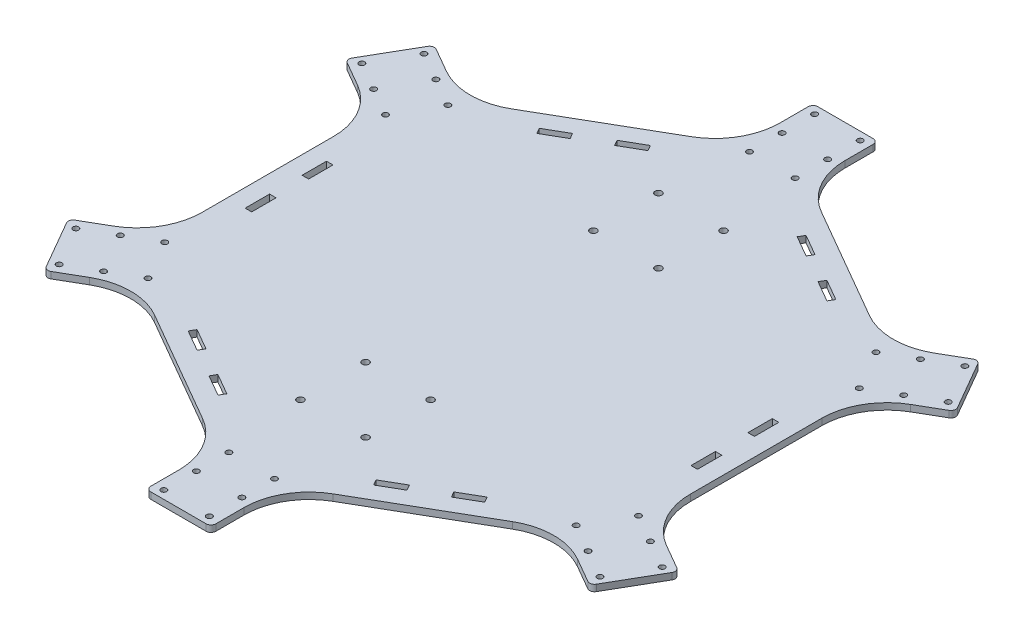
from build123d import *

# Parameters (mm, degrees)
SKETCH4_R                  = 1.75
SKETCH4_W                  = 4
SKETCH4_H                  = 15
BOSS_EXTRUDE3_DEPTH        = 2
FILLET1_R                  = 3
CIRPATTERN4_START          = -2
CIRPATTERN4_DEPTH          = 4
M5_TAPPED_HOLE1_AT_2_COUNT = 2
M5_TAPPED_HOLE1_AT_2_PITCH = 40
M5_TAPPED_HOLE1_AT_3_COUNT = 2
M5_TAPPED_HOLE1_AT_3_PITCH = 40
M5_TAPPED_HOLE1_AT_4_COUNT = 2
M5_TAPPED_HOLE1_AT_4_PITCH = 56.568542495


# Read off the part's stored shape, not the designer's step: CirPattern4
with BuildPart() as part:
    # Sketch4 → Boss-Extrude3 (new, symmetric)
    with BuildSketch(Plane(origin=(0, 0, 0), x_dir=(1, 0, 0), z_dir=(0, 1, 0))):
        with BuildLine():
            Line((-109.999962696, -109.696549489), (-39.999982783, -150.111103124))
            ThreePointArc((-39.999982783, -150.111103124), (-25.358978878, -164.752117943), (-20, -184.752109335))
            Line((-20, -184.752109335), (-20, -205))
            Line((-20, -205), (20, -205))
            Line((20, -205), (20, -184.752062947))
            ThreePointArc((20, -184.752062947), (25.358988819, -164.752054338), (40.000017217, -150.111036855))
            Line((40.000017217, -150.111036855), (110.000037304, -109.696552803))
            ThreePointArc((110.000037304, -109.696552803), (130.000030027, -104.337578894), (150.000020087, -109.696562743))
            Line((150.000020087, -109.696562743), (167.535207776, -119.820508076))
            Line((167.535207776, -119.820508076), (187.535207776, -85.179491924))
            Line((187.535207776, -85.179491924), (169.999979913, -75.055523398))
            ThreePointArc((169.999979913, -75.055523398), (155.358958792, -60.414498638), (149.999979913, -40.414487366))
            Line((149.999979913, -40.414487366), (150.000020087, 40.414550321))
            ThreePointArc((150.000020087, 40.414550321), (155.359008905, 60.414539049), (170.000020087, 75.055546592))
            Line((170.000020087, 75.055546592), (187.535207776, 85.179491924))
            Line((187.535207776, 85.179491924), (167.535207776, 119.820508076))
            Line((167.535207776, 119.820508076), (149.999979913, 109.696539549))
            ThreePointArc((149.999979913, 109.696539549), (129.999969973, 104.3375557), (109.999962696, 109.696549489))
            Line((109.999962696, 109.696549489), (39.999982783, 150.111103124))
            ThreePointArc((39.999982783, 150.111103124), (25.358978878, 164.752117943), (20, 184.752109335))
            Line((20, 184.752109335), (20, 205))
            Line((20, 205), (-20, 205))
            Line((-20, 205), (-20, 184.752062947))
            ThreePointArc((-20, 184.752062947), (-25.358988819, 164.752054338), (-40.000017217, 150.111036855))
            Line((-40.000017217, 150.111036855), (-110.000037304, 109.696552803))
            ThreePointArc((-110.000037304, 109.696552803), (-130.000030027, 104.337578894), (-150.000020087, 109.696562743))
            Line((-150.000020087, 109.696562743), (-167.535207776, 119.820508076))
            Line((-167.535207776, 119.820508076), (-187.535207776, 85.179491924))
            Line((-187.535207776, 85.179491924), (-169.999979913, 75.055523398))
            ThreePointArc((-169.999979913, 75.055523398), (-155.358958792, 60.414498638), (-149.999979913, 40.414487366))
            Line((-149.999979913, 40.414487366), (-150.000020087, -40.414550321))
            ThreePointArc((-150.000020087, -40.414550321), (-155.359008905, -60.414539049), (-170.000020087, -75.055546592))
            Line((-170.000020087, -75.055546592), (-187.535207776, -85.179491924))
            Line((-187.535207776, -85.179491924), (-167.535207776, -119.820508076))
            Line((-167.535207776, -119.820508076), (-149.999979913, -109.696539549))
            ThreePointArc((-149.999979913, -109.696539549), (-129.999969973, -104.3375557), (-109.999962696, -109.696549489))
        make_face()
        with Locations(Location((-14, 200, 0), (0, 0, 270))):
            Circle(SKETCH4_R, mode=Mode.SUBTRACT)
        with Locations(Location((-14, 180, 0), (0, 0, 270))):
            Circle(SKETCH4_R, mode=Mode.SUBTRACT)
        with Locations(Location((-14, 160, 0), (0, 0, 270))):
            Circle(SKETCH4_R, mode=Mode.SUBTRACT)
        with Locations(Location((14, 200, 0), (0, 0, 270))):
            Circle(SKETCH4_R, mode=Mode.SUBTRACT)
        with Locations(Location((14, 180, 0), (0, 0, 270))):
            Circle(SKETCH4_R, mode=Mode.SUBTRACT)
        with Locations(Location((14, 160, 0), (0, 0, 270))):
            Circle(SKETCH4_R, mode=Mode.SUBTRACT)
        with Locations(Location((131.564064606, 92.124355653, 0), (0, 0, 270))):
            Circle(SKETCH4_R, mode=Mode.SUBTRACT)
        with Locations(Location((148.884572681, 102.124355653, 0), (0, 0, 270))):
            Circle(SKETCH4_R, mode=Mode.SUBTRACT)
        with Locations(Location((145.564064606, 67.875644347, 0), (0, 0, 270))):
            Circle(SKETCH4_R, mode=Mode.SUBTRACT)
        with Locations(Location((180.205080757, 87.875644347, 0), (0, 0, 270))):
            Circle(SKETCH4_R, mode=Mode.SUBTRACT)
        with Locations(Location((162.884572681, 77.875644347, 0), (0, 0, 270))):
            Circle(SKETCH4_R, mode=Mode.SUBTRACT)
        with Locations(Location((166.205080757, 112.124355653, 0), (0, 0, 270))):
            Circle(SKETCH4_R, mode=Mode.SUBTRACT)
        with Locations(Location((145.564064606, -67.875644347, 0), (0, 0, 270))):
            Circle(SKETCH4_R, mode=Mode.SUBTRACT)
        with Locations(Location((162.884572681, -77.875644347, 0), (0, 0, 270))):
            Circle(SKETCH4_R, mode=Mode.SUBTRACT)
        with Locations(Location((131.564064606, -92.124355653, 0), (0, 0, 270))):
            Circle(SKETCH4_R, mode=Mode.SUBTRACT)
        with Locations(Location((166.205080757, -112.124355653, 0), (0, 0, 270))):
            Circle(SKETCH4_R, mode=Mode.SUBTRACT)
        with Locations(Location((148.884572681, -102.124355653, 0), (0, 0, 270))):
            Circle(SKETCH4_R, mode=Mode.SUBTRACT)
        with Locations(Location((180.205080757, -87.875644347, 0), (0, 0, 270))):
            Circle(SKETCH4_R, mode=Mode.SUBTRACT)
        with Locations(Location((14, -160, 0), (0, 0, 270))):
            Circle(SKETCH4_R, mode=Mode.SUBTRACT)
        with Locations(Location((14, -180, 0), (0, 0, 270))):
            Circle(SKETCH4_R, mode=Mode.SUBTRACT)
        with Locations(Location((-14, -160, 0), (0, 0, 270))):
            Circle(SKETCH4_R, mode=Mode.SUBTRACT)
        with Locations(Location((-14, -200, 0), (0, 0, 270))):
            Circle(SKETCH4_R, mode=Mode.SUBTRACT)
        with Locations(Location((-14, -180, 0), (0, 0, 270))):
            Circle(SKETCH4_R, mode=Mode.SUBTRACT)
        with Locations(Location((14, -200, 0), (0, 0, 270))):
            Circle(SKETCH4_R, mode=Mode.SUBTRACT)
        with Locations(Location((-131.564064605, -92.124355653, 0), (0, 0, 270))):
            Circle(SKETCH4_R, mode=Mode.SUBTRACT)
        with Locations(Location((-148.884572681, -102.124355653, 0), (0, 0, 270))):
            Circle(SKETCH4_R, mode=Mode.SUBTRACT)
        with Locations(Location((-145.564064605, -67.875644347, 0), (0, 0, 270))):
            Circle(SKETCH4_R, mode=Mode.SUBTRACT)
        with Locations(Location((-180.205080757, -87.875644347, 0), (0, 0, 270))):
            Circle(SKETCH4_R, mode=Mode.SUBTRACT)
        with Locations(Location((-162.884572681, -77.875644347, 0), (0, 0, 270))):
            Circle(SKETCH4_R, mode=Mode.SUBTRACT)
        with Locations(Location((-166.205080757, -112.124355653, 0), (0, 0, 270))):
            Circle(SKETCH4_R, mode=Mode.SUBTRACT)
        with Locations(Location((-145.564064606, 67.875644347, 0), (0, 0, 270))):
            Circle(SKETCH4_R, mode=Mode.SUBTRACT)
        with Locations(Location((-162.884572681, 77.875644347, 0), (0, 0, 270))):
            Circle(SKETCH4_R, mode=Mode.SUBTRACT)
        with Locations(Location((-131.564064606, 92.124355653, 0), (0, 0, 270))):
            Circle(SKETCH4_R, mode=Mode.SUBTRACT)
        with Locations(Location((-166.205080757, 112.124355653, 0), (0, 0, 270))):
            Circle(SKETCH4_R, mode=Mode.SUBTRACT)
        with Locations(Location((-148.884572681, 102.124355653, 0), (0, 0, 270))):
            Circle(SKETCH4_R, mode=Mode.SUBTRACT)
        with Locations(Location((-180.205080757, 87.875644347, 0), (0, 0, 270))):
            Circle(SKETCH4_R, mode=Mode.SUBTRACT)
        with Locations((137, 17.5)):
            Rectangle(SKETCH4_W, SKETCH4_H, mode=Mode.SUBTRACT)
        with Locations((137, -17.5)):
            Rectangle(SKETCH4_W, SKETCH4_H, mode=Mode.SUBTRACT)
        Polygon((60.839745962, -125.377531126), (47.849364905, -132.877531126), (45.849364905, -129.413429511), (58.839745962, -121.913429511), align=None, mode=Mode.SUBTRACT)
        Polygon((76.160254038, -111.913429511), (78.160254038, -115.377531126), (91.150635095, -107.877531126), (89.150635095, -104.413429511), align=None, mode=Mode.SUBTRACT)
        Polygon((-78.160254038, -115.377531126), (-91.150635095, -107.877531126), (-89.150635095, -104.413429511), (-76.160254038, -111.913429511), align=None, mode=Mode.SUBTRACT)
        Polygon((-58.839745962, -121.913429511), (-60.839745962, -125.377531126), (-47.849364905, -132.877531126), (-45.849364905, -129.413429511), align=None, mode=Mode.SUBTRACT)
        with Locations((-137, 17.5)):
            Rectangle(SKETCH4_W, SKETCH4_H, mode=Mode.SUBTRACT)
        with Locations((-137, -17.5)):
            Rectangle(SKETCH4_W, SKETCH4_H, mode=Mode.SUBTRACT)
        Polygon((-60.839745962, 125.377531126), (-47.849364905, 132.877531126), (-45.849364905, 129.413429511), (-58.839745962, 121.913429511), align=None, mode=Mode.SUBTRACT)
        Polygon((-76.160254038, 111.913429511), (-78.160254038, 115.377531126), (-91.150635095, 107.877531126), (-89.150635095, 104.413429511), align=None, mode=Mode.SUBTRACT)
        Polygon((78.160254038, 115.377531126), (91.150635095, 107.877531126), (89.150635095, 104.413429511), (76.160254038, 111.913429511), align=None, mode=Mode.SUBTRACT)
        Polygon((58.839745962, 121.913429511), (60.839745962, 125.377531126), (47.849364905, 132.877531126), (45.849364905, 129.413429511), align=None, mode=Mode.SUBTRACT)
    extrude(amount=BOSS_EXTRUDE3_DEPTH, both=True)

    # Fillet1
    fillet1_edges = [part.edges().sort_by_distance(p)[0] for p in [
        (-20, 0, -205),
        (20, 0, -205),
    ]]
    fillet(fillet1_edges, radius=FILLET1_R)

    # CirPattern4 outline → CirPattern4 (cut)
    with BuildSketch(Plane(origin=(0, 0, 0), x_dir=(1, 0, 0), z_dir=(0, 1, 0)).offset(CIRPATTERN4_START)):
        with BuildLine():
            Line((187.535207776, 85.179491924), (186.035207776, 87.777568136))
            ThreePointArc((186.035207776, 87.777568136), (186.334909043, 85.501111), (184.937131564, 83.679491924))
            Line((184.937131564, 83.679491924), (187.535207776, 85.179491924))
        make_face()
        with BuildLine():
            ThreePointArc((164.937131564, 118.320508076), (167.2135887, 118.620209343), (169.035207776, 117.222431864))
            Line((169.035207776, 117.222431864), (167.535207776, 119.820508076))
            Line((167.535207776, 119.820508076), (164.937131564, 118.320508076))
        make_face()
        with BuildLine():
            Line((167.535207776, -119.820508076), (169.035207776, -117.222431864))
            ThreePointArc((169.035207776, -117.222431864), (167.2135887, -118.620209343), (164.937131564, -118.320508076))
            Line((164.937131564, -118.320508076), (167.535207776, -119.820508076))
        make_face()
        with BuildLine():
            ThreePointArc((184.937131564, -83.679491924), (186.334909043, -85.501111), (186.035207776, -87.777568136))
            Line((186.035207776, -87.777568136), (187.535207776, -85.179491924))
            Line((187.535207776, -85.179491924), (184.937131564, -83.679491924))
        make_face()
        with BuildLine():
            Line((-20, -205), (-17, -205))
            ThreePointArc((-17, -205), (-19.121320344, -204.121320344), (-20, -202))
            Line((-20, -202), (-20, -205))
        make_face()
        with BuildLine():
            ThreePointArc((20, -202), (19.121320343, -204.121320344), (17, -205))
            Line((17, -205), (20, -205))
            Line((20, -205), (20, -202))
        make_face()
        with BuildLine():
            Line((-187.535207776, -85.179491924), (-186.035207776, -87.777568136))
            ThreePointArc((-186.035207776, -87.777568136), (-186.334909043, -85.501111), (-184.937131564, -83.679491924))
            Line((-184.937131564, -83.679491924), (-187.535207776, -85.179491924))
        make_face()
        with BuildLine():
            ThreePointArc((-164.937131564, -118.320508076), (-167.2135887, -118.620209343), (-169.035207776, -117.222431864))
            Line((-169.035207776, -117.222431864), (-167.535207776, -119.820508076))
            Line((-167.535207776, -119.820508076), (-164.937131564, -118.320508076))
        make_face()
        with BuildLine():
            Line((-167.535207776, 119.820508076), (-169.035207776, 117.222431864))
            ThreePointArc((-169.035207776, 117.222431864), (-167.2135887, 118.620209343), (-164.937131564, 118.320508076))
            Line((-164.937131564, 118.320508076), (-167.535207776, 119.820508076))
        make_face()
        with BuildLine():
            ThreePointArc((-184.937131564, 83.679491924), (-186.334909043, 85.501111), (-186.035207776, 87.777568136))
            Line((-186.035207776, 87.777568136), (-187.535207776, 85.179491924))
            Line((-187.535207776, 85.179491924), (-184.937131564, 83.679491924))
        make_face()
    extrude(amount=CIRPATTERN4_DEPTH, mode=Mode.SUBTRACT)

    # Sketch16 → M5 Tapped Hole1 (revolve, cut)
    with BuildSketch(Plane(origin=(-20, 2, -110), x_dir=(0, 0, 1), z_dir=(1, 0, 0))):
        Polygon((0, 0), (0, 15.2618073), (2.1, 14), (2.1, 0), align=None)
    m5_tapped_hole1 = revolve(axis=Axis((-20, 8.35, -110), (0, -1, 0)), mode=Mode.SUBTRACT)

    # M5 Tapped Hole1 at 2: M5 Tapped Hole1 ×2
    with Locations(*[(0, 0, i * M5_TAPPED_HOLE1_AT_2_PITCH) for i in range(1, M5_TAPPED_HOLE1_AT_2_COUNT)]):
        add(m5_tapped_hole1, mode=Mode.SUBTRACT)

    # M5 Tapped Hole1 at 3: M5 Tapped Hole1 ×2
    with Locations(*[(i * M5_TAPPED_HOLE1_AT_3_PITCH, 0, 0) for i in range(1, M5_TAPPED_HOLE1_AT_3_COUNT)]):
        add(m5_tapped_hole1, mode=Mode.SUBTRACT)

    # M5 Tapped Hole1 at 4: M5 Tapped Hole1 ×2
    with Locations(*[Vector(0.7071067811865475, 0, 0.7071067811865477) * (i * M5_TAPPED_HOLE1_AT_4_PITCH) for i in range(1, M5_TAPPED_HOLE1_AT_4_COUNT)]):
        add(m5_tapped_hole1, mode=Mode.SUBTRACT)

    # Mirror1: M5 Tapped Hole1 across plane
    add(m5_tapped_hole1.mirror(Plane.XY), mode=Mode.SUBTRACT)

    # Mirror1 copy 1 sketch → Mirror1 copy 1 (revolve, cut)
    with BuildSketch(Plane(origin=(-20, 2, 70), x_dir=(0, 0, -1), z_dir=(1, 0, 0))):
        Polygon((0, 0), (0, -15.2618073), (2.1, -14), (2.1, 0), align=None)
    revolve(axis=Axis((-20, 8.35, 70), (0, 1, 0)), mode=Mode.SUBTRACT)

    # Mirror1 copy 2 sketch → Mirror1 copy 2 (revolve, cut)
    with BuildSketch(Plane(origin=(20, 2, 110), x_dir=(0, 0, -1), z_dir=(1, 0, 0))):
        Polygon((0, 0), (0, -15.2618073), (2.1, -14), (2.1, 0), align=None)
    revolve(axis=Axis((20, 8.35, 110), (0, 1, 0)), mode=Mode.SUBTRACT)

    # Mirror1 copy 3 sketch → Mirror1 copy 3 (revolve, cut)
    with BuildSketch(Plane(origin=(20, 2, 70), x_dir=(0, 0, -1), z_dir=(1, 0, 0))):
        Polygon((0, 0), (0, -15.2618073), (2.1, -14), (2.1, 0), align=None)
    revolve(axis=Axis((20, 8.35, 70), (0, 1, 0)), mode=Mode.SUBTRACT)


solid = part.part
